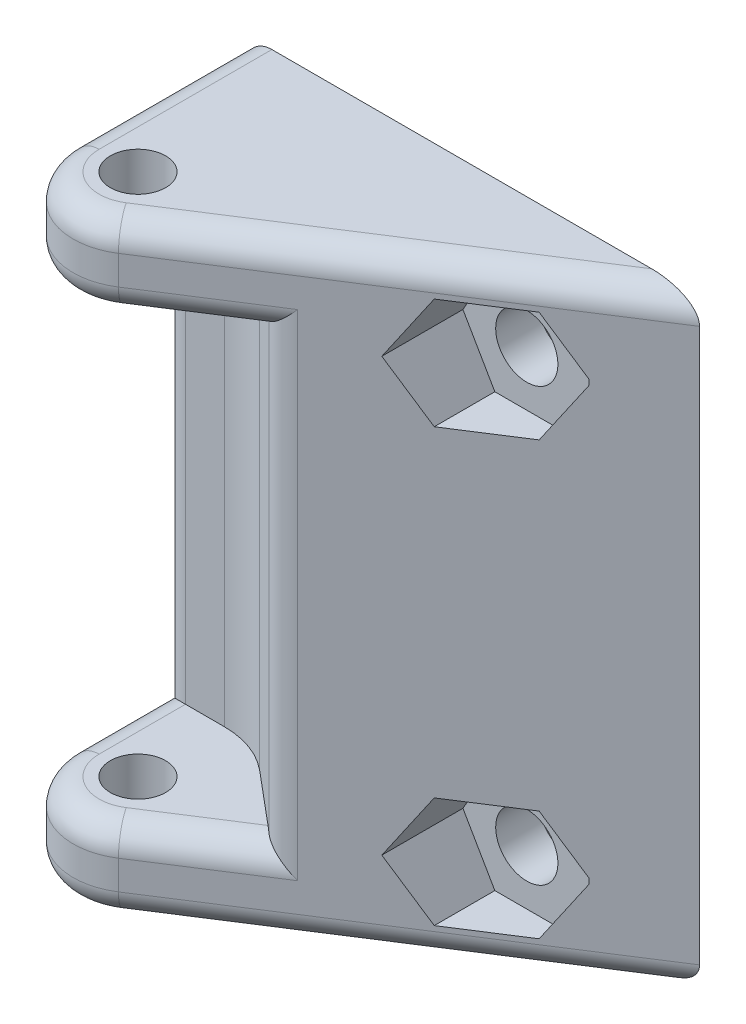
from build123d import *

# Parameters (mm, degrees)
SKETCH1_R           = 2.032
BOSS_EXTRUDE1_DEPTH = 22.225
CUT_EXTRUDE4_DEPTH  = 16.271875
SKETCH13_R          = 2.286
CUT_EXTRUDE9_DEPTH  = 41.192289761
CUT_EXTRUDE10_START = -3.175
CUT_EXTRUDE10_DEPTH = 38.017289761
FILLET1_R           = 1.905


with BuildPart() as part:
    # Sketch1 → Boss-Extrude1 (new, symmetric)
    with BuildSketch(Plane(origin=(0, 0, 0), x_dir=(1, 0, 0), z_dir=(0, 1, 0))):
        with BuildLine():
            Line((-4.7625, 12.7), (-4.7625, 0))
            ThreePointArc((-4.7625, 0), (-2.282585023, -4.179857876), (2.574491858, -4.006669181))
            Line((2.574491858, -4.006669181), (28.575, 12.7))
            Line((28.575, 12.7), (-4.7625, 12.7))
        make_face()
        Circle(SKETCH1_R, mode=Mode.SUBTRACT)
    extrude(amount=BOSS_EXTRUDE1_DEPTH, both=True)

    # Sketch6 → Cut-Extrude4 (cut, symmetric)
    with BuildSketch(Plane(origin=(0, 0, 0), x_dir=(1, 0, 0), z_dir=(0, 1, 0))):
        with BuildLine():
            Line((0, 6.35), (-4.7625, 6.35))
            Line((-4.7625, 6.35), (-4.7625, 0))
            ThreePointArc((-4.7625, 0), (-2.282585023, -4.179857876), (2.574491858, -4.006669181))
            Line((2.574491858, -4.006669181), (9.415339288, 0.388928563))
            Line((9.415339288, 0.388928563), (4.081701322, 4.864382214))
            ThreePointArc((4.081701322, 4.864382214), (2.17182791, 5.967048142), (0, 6.35))
        make_face()
    extrude(amount=CUT_EXTRUDE4_DEPTH, both=True, mode=Mode.SUBTRACT)

    # Sketch13 → Cut-Extrude9 (cut, through all)
    with BuildSketch(Plane(origin=(0, 0, -12.7), x_dir=(-1, 0, 0), z_dir=(0, 0, -1))):
        with Locations((-19.05, 15.875)):
            Circle(SKETCH13_R)
        with Locations((-19.05, -15.875)):
            Circle(SKETCH13_R)
    extrude(amount=-CUT_EXTRUDE9_DEPTH, mode=Mode.SUBTRACT)

    # Sketch14 → Cut-Extrude10 (cut, through all)
    with BuildSketch(Plane(origin=(0, 0, -12.7), x_dir=(-1, 0, 0), z_dir=(0, 0, -1)).offset(CUT_EXTRUDE10_START)):
        Polygon((-16.703648506, 19.939), (-21.396351494, 19.939), (-23.742702988, 15.875), (-21.396351494, 11.811), (-16.703648506, 11.811), (-14.357297012, 15.875), align=None)
        Polygon((-14.357297012, -15.875), (-16.703648506, -11.811), (-21.396351494, -11.811), (-23.742702988, -15.875), (-21.396351494, -19.939), (-16.703648506, -19.939), align=None)
    extrude(amount=-CUT_EXTRUDE10_DEPTH, mode=Mode.SUBTRACT)

    # Fillet1
    fillet1_edges = [part.edges().sort_by_distance(p)[0] for p in [
        (-4.7625, -22.225, -6.35),
        (-2.282585023, -22.225, 4.179857876),
        (15.574745929, 22.225, -4.34666541),
        (-2.282585023, 22.225, 4.179857876),
        (15.574745929, -22.225, -4.34666541),
        (-4.7625, 22.225, -6.35),
        (-4.7625, -16.271875, -3.175),
        (5.994915573, -16.271875, 1.808870309),
        (-4.7625, 16.271875, -3.175),
        (-2.282585023, 16.271875, 4.179857876),
        (-2.282585023, -16.271875, 4.179857876),
        (5.994915573, 16.271875, 1.808870309),
        (-4.7625, 0, -6.35),
        (9.415339288, 0, -0.388928563),
    ]]
    fillet(fillet1_edges, radius=FILLET1_R)


solid = part.part
